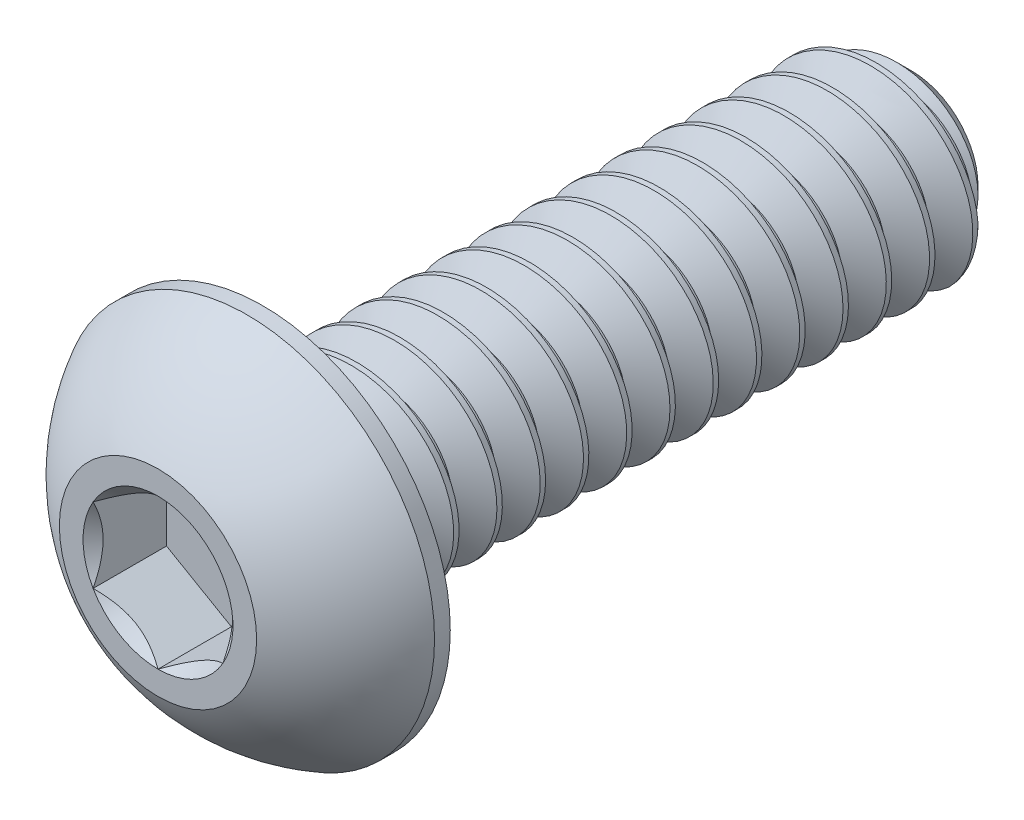
from build123d import *

# Parameters (mm, degrees)
SKETCH1_W          = 15.875
SKETCH1_H          = 2.413
CHAMFER1_SIZE      = 0.79375
CUT_SWEEP1_PITCH   = 1.058333333
CUT_EXTRUDE2_DEPTH = 1.79578
SKETCH6_R          = 1.833087105
CUT_EXTRUDE3_DEPTH = 1.79578
CUT_EXTRUDE3_TAPER = 45


with BuildPart() as part:
    # Sketch1 → Revolve1 (revolve)
    with BuildSketch(Plane(origin=(0, 0, 0), x_dir=(0, 0, -1), z_dir=(1, 0, 0))):
        with Locations((10.5029, 1.2065)):
            Rectangle(SKETCH1_W, SKETCH1_H)
    revolve(axis=Axis((0, 0, -18.4404), (0, 0, 1)))

    # Chamfer1
    chamfer1_edges = [part.edges().sort_by_distance(p)[0] for p in [
        (0, -2.413, -18.4404),
    ]]
    chamfer(chamfer1_edges, length=CHAMFER1_SIZE)

    # Cut-Sweep1: arcs per turn and ends read off the stored shape
    # Cut-Sweep1: the profile of Sketch2 profile screwed along a right-hand helix through 16 turns, 8 arcs to a turn; built about Z, then put on its axis
    cut_sweep1_z = Axis((0, 0, 0), (0, 0, 1))
    cut_sweep1_corners = [(2.4133, 0, 0.000173205), (2.4133, 0, -0.926214872), (1.725592336, 0, -0.529166667), (1.725592336, 0, -0.396875)]
    with BuildLine(mode=Mode.PRIVATE) as cut_sweep1_profile:
        Line(cut_sweep1_corners[0], cut_sweep1_corners[1])
        Line(cut_sweep1_corners[1], cut_sweep1_corners[2])
        Line(cut_sweep1_corners[2], cut_sweep1_corners[3])
        Line(cut_sweep1_corners[3], cut_sweep1_corners[0])
    cut_sweep1_cap = Face(cut_sweep1_profile.wire())
    cut_sweep1_turn_angles = [0, 22.5, 45, 67.5, 90, 112.5, 135, 157.5, 180, 202.5, 225, 247.5, 270, 292.5, 315, 337.5, 360]
    cut_sweep1_turn_weights = [1, 0.9238795325112867, 1, 0.9238795325112867, 1, 0.9238795325112867, 1, 0.9238795325112867, 1, 0.9238795325112867, 1, 0.9238795325112867, 1, 0.9238795325112867, 1, 0.9238795325112867, 1]
    cut_sweep1_turn_rails = [Edge.make_bspline([Vector(p[0], p[1], 0).rotate(cut_sweep1_z, cut_sweep1_turn_angles[k]) / cut_sweep1_turn_weights[k] + Vector(0, 0, p[2] + CUT_SWEEP1_PITCH * cut_sweep1_turn_angles[k] / 360) for k in range(17)], [0, 0, 0, 1, 1, 2, 2, 3, 3, 4, 4, 5, 5, 6, 6, 7, 7, 8, 8, 8], 2, cut_sweep1_turn_weights) for p in cut_sweep1_corners]
    cut_sweep1_turn_sides = [Face.make_surface_from_curves(cut_sweep1_turn_rails[p[0]], cut_sweep1_turn_rails[p[1]]) for p in [(0, 1), (1, 2), (2, 3), (3, 0)]]
    cut_sweep1 = Plane(origin=(0, 0, -18.4404), x_dir=(0, 1, 0), z_dir=(0, 0, 1)) * Solid(Shell([*[p.moved(Location((0, 0, CUT_SWEEP1_PITCH * i))) for i in range(16) for p in cut_sweep1_turn_sides], cut_sweep1_cap, cut_sweep1_cap.rotate(cut_sweep1_z, 5760).moved(Location((0, 0, CUT_SWEEP1_PITCH * 5760 / 360)))]))
    add(cut_sweep1, mode=Mode.SUBTRACT)

    # Sketch7 → Revolve2 (revolve)
    with BuildSketch(Plane(origin=(0, 0, 0), x_dir=(0, 0, -1), z_dir=(1, 0, 0)), mode=Mode.PRIVATE) as revolve2_sk:
        with BuildLine():
            Line((2.18059, 4.5847), (2.5654, 4.5847))
            Line((2.5654, 4.5847), (2.5654, 0))
            Line((2.5654, 0), (0, 0))
            Line((0, 0), (0, 2.413))
            ThreePointArc((0, 2.413), (0.925030326, 3.664791196), (2.18059, 4.5847))
        make_face()
    revolve(revolve2_sk.sketch.rotate(Axis((0, 0, 0), (0, 0, -1)), 189.052465708), axis=Axis((0, 0, 0), (0, 0, -1)))

    # Sketch5 → Cut-Extrude2 (cut)
    with BuildSketch(Plane.XY):
        Polygon((1.5875, -0.916543552), (1.5875, 0.916543552), (0, 1.833087105), (-1.5875, 0.916543552), (-1.5875, -0.916543552), (0, -1.833087105), align=None)
    extrude(amount=-CUT_EXTRUDE2_DEPTH, mode=Mode.SUBTRACT)

    # Sketch6 → Cut-Extrude3 (cut)
    with BuildSketch(Plane.XY):
        Circle(SKETCH6_R)
    extrude(amount=-CUT_EXTRUDE3_DEPTH, taper=CUT_EXTRUDE3_TAPER, mode=Mode.SUBTRACT)


solid = part.part
